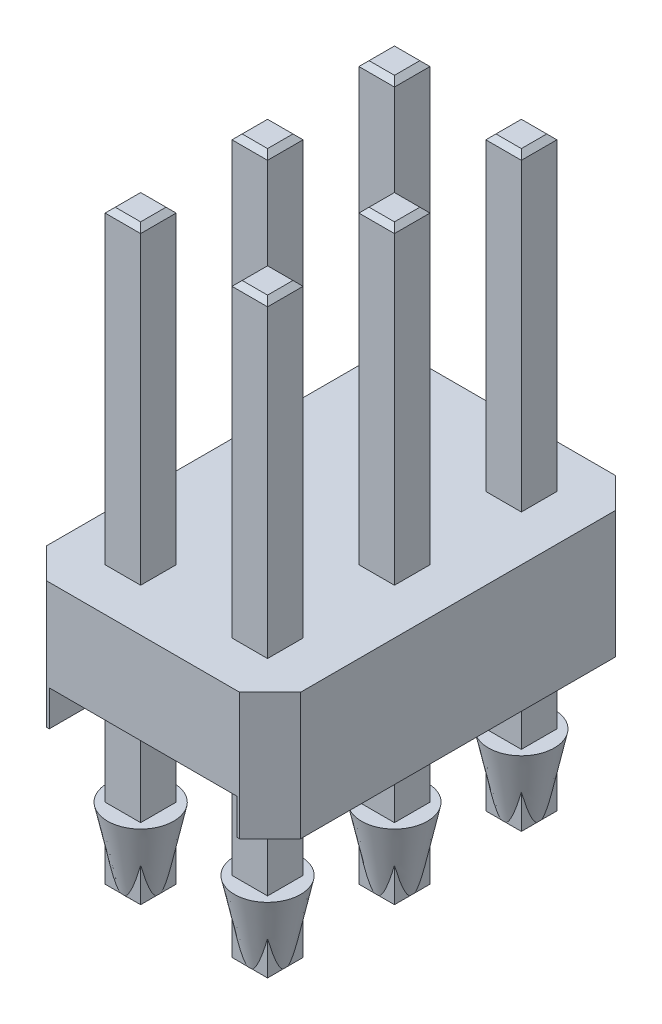
from build123d import *

# Parameters (mm, degrees)
ESQUISSE1_W                  = 5
ESQUISSE1_H                  = 7.4
BOSS_EXTRU_1_DEPTH           = 2.5
ESQUISSE3_W                  = 3.7
ESQUISSE3_H                  = 0.7
ENL_V_MAT_EXTRU_1_DEPTH      = 10.274157644
BOSS_EXTRU_2_DEPTH           = 6.1
BOSS_EXTRU_2_DEPTH_BACK      = 5.5
ESQUISSE2_W                  = 0.7
ESQUISSE2_H                  = 0.7
ESQUISSE4_R                  = 0.65
BOSS_EXTRU_3_DEPTH           = 1.4
BOSS_EXTRU_3_DRAFT           = -12
BOSS_EXTRU_3_PROFILE_2_DEPTH = 1.4
BOSS_EXTRU_3_PROFILE_2_DRAFT = -12
BOSS_EXTRU_3_PROFILE_3_DEPTH = 1.4
BOSS_EXTRU_3_PROFILE_3_DRAFT = -12
BOSS_EXTRU_3_PROFILE_4_DEPTH = 1.4
BOSS_EXTRU_3_PROFILE_4_DRAFT = -12
BOSS_EXTRU_3_PROFILE_5_DEPTH = 1.4
BOSS_EXTRU_3_PROFILE_5_DRAFT = -12
BOSS_EXTRU_3_PROFILE_6_DEPTH = 1.4
BOSS_EXTRU_3_PROFILE_6_DRAFT = -12
CHANFREIN1_SIZE              = 0.1
CHANFREIN2_SIZE              = 0.6
CHANFREIN3_SIZE              = 0.05


with BuildPart() as part:
    # Esquisse1 → Boss.-Extru.1 (new body)
    with BuildSketch(Plane(origin=(0, 0, 0), x_dir=(1, 0, 0), z_dir=(0, 1, 0))):
        with Locations((2.5, 3.7)):
            Rectangle(ESQUISSE1_W, ESQUISSE1_H)
    extrude(amount=BOSS_EXTRU_1_DEPTH)

    # Esquisse3 → Enlèv. mat.-Extru.1 (cut, through all)
    with BuildSketch(Plane.XY):
        with Locations((2.5, 0.35)):
            Rectangle(ESQUISSE3_W, ESQUISSE3_H)
    extrude(amount=-ENL_V_MAT_EXTRU_1_DEPTH, mode=Mode.SUBTRACT)

    # Esquisse2 → Boss.-Extru.2 (add, two sides: drawn at the far end of the back side and taken through both)
    with BuildSketch(Plane(origin=(0, 2.5, 0), x_dir=(1, 0, 0), z_dir=(0, 1, 0)).offset(-BOSS_EXTRU_2_DEPTH_BACK)):
        with Locations((1.25, 6.2)):
            Rectangle(ESQUISSE2_W, ESQUISSE2_H)
        with Locations((3.75, 6.2)):
            Rectangle(ESQUISSE2_W, ESQUISSE2_H)
        with Locations((1.25, 3.7)):
            Rectangle(ESQUISSE2_W, ESQUISSE2_H)
        with Locations((3.75, 3.7)):
            Rectangle(ESQUISSE2_W, ESQUISSE2_H)
        with Locations((1.25, 1.2)):
            Rectangle(ESQUISSE2_W, ESQUISSE2_H)
        with Locations((3.75, 1.2)):
            Rectangle(ESQUISSE2_W, ESQUISSE2_H)
    extrude(amount=BOSS_EXTRU_2_DEPTH + BOSS_EXTRU_2_DEPTH_BACK)


with BuildPart() as boss_extru_3_tool:
    # Esquisse4 → Boss.-Extru.3 (with draft: the straight prism first)
    with BuildSketch(Plane(origin=(0, -1.55, 0), x_dir=(1, 0, 0), z_dir=(0, 1, 0))):
        with Locations((1.25, 6.2)):
            Circle(ESQUISSE4_R)
    extrude(amount=-BOSS_EXTRU_3_DEPTH)
    # Boss.-Extru.3: the draft: its side faces are tilted about the plane it starts from
    boss_extru_3_sides = [boss_extru_3_tool.faces().sort_by_distance(p)[0] for p in [
        (0.6, -2.25, -6.2),
    ]]
    draft(boss_extru_3_sides, Plane(origin=(0, -1.55, 0), x_dir=(1, 0, 0), z_dir=(0, 1, 0)), BOSS_EXTRU_3_DRAFT)


with BuildPart() as part_1:
    add(part.part)

    # Boss.-Extru.3: add boss_extru_3_tool
    add(boss_extru_3_tool.part)


with BuildPart() as boss_extru_3_profile_2_tool:
    # Esquisse4 → Boss.-Extru.3 profile 2 (with draft: the straight prism first)
    with BuildSketch(Plane(origin=(0, -1.55, 0), x_dir=(1, 0, 0), z_dir=(0, 1, 0))):
        with Locations((1.25, 3.7)):
            Circle(ESQUISSE4_R)
    extrude(amount=-BOSS_EXTRU_3_PROFILE_2_DEPTH)
    # Boss.-Extru.3 profile 2: the draft: its side faces are tilted about the plane it starts from
    boss_extru_3_profile_2_sides = [boss_extru_3_profile_2_tool.faces().sort_by_distance(p)[0] for p in [
        (0.6, -2.25, -3.7),
    ]]
    draft(boss_extru_3_profile_2_sides, Plane(origin=(0, -1.55, 0), x_dir=(1, 0, 0), z_dir=(0, 1, 0)), BOSS_EXTRU_3_PROFILE_2_DRAFT)


with BuildPart() as part_2:
    add(part_1.part)

    # Boss.-Extru.3 profile 2: add boss_extru_3_profile_2_tool
    add(boss_extru_3_profile_2_tool.part)


with BuildPart() as boss_extru_3_profile_3_tool:
    # Esquisse4 → Boss.-Extru.3 profile 3 (with draft: the straight prism first)
    with BuildSketch(Plane(origin=(0, -1.55, 0), x_dir=(1, 0, 0), z_dir=(0, 1, 0))):
        with Locations((1.25, 1.2)):
            Circle(ESQUISSE4_R)
    extrude(amount=-BOSS_EXTRU_3_PROFILE_3_DEPTH)
    # Boss.-Extru.3 profile 3: the draft: its side faces are tilted about the plane it starts from
    boss_extru_3_profile_3_sides = [boss_extru_3_profile_3_tool.faces().sort_by_distance(p)[0] for p in [
        (0.6, -2.25, -1.2),
    ]]
    draft(boss_extru_3_profile_3_sides, Plane(origin=(0, -1.55, 0), x_dir=(1, 0, 0), z_dir=(0, 1, 0)), BOSS_EXTRU_3_PROFILE_3_DRAFT)


with BuildPart() as part_3:
    add(part_2.part)

    # Boss.-Extru.3 profile 3: add boss_extru_3_profile_3_tool
    add(boss_extru_3_profile_3_tool.part)


with BuildPart() as boss_extru_3_profile_4_tool:
    # Esquisse4 → Boss.-Extru.3 profile 4 (with draft: the straight prism first)
    with BuildSketch(Plane(origin=(0, -1.55, 0), x_dir=(1, 0, 0), z_dir=(0, 1, 0))):
        with Locations((3.75, 6.2)):
            Circle(ESQUISSE4_R)
    extrude(amount=-BOSS_EXTRU_3_PROFILE_4_DEPTH)
    # Boss.-Extru.3 profile 4: the draft: its side faces are tilted about the plane it starts from
    boss_extru_3_profile_4_sides = [boss_extru_3_profile_4_tool.faces().sort_by_distance(p)[0] for p in [
        (3.1, -2.25, -6.2),
    ]]
    draft(boss_extru_3_profile_4_sides, Plane(origin=(0, -1.55, 0), x_dir=(1, 0, 0), z_dir=(0, 1, 0)), BOSS_EXTRU_3_PROFILE_4_DRAFT)


with BuildPart() as part_4:
    add(part_3.part)

    # Boss.-Extru.3 profile 4: add boss_extru_3_profile_4_tool
    add(boss_extru_3_profile_4_tool.part)


with BuildPart() as boss_extru_3_profile_5_tool:
    # Esquisse4 → Boss.-Extru.3 profile 5 (with draft: the straight prism first)
    with BuildSketch(Plane(origin=(0, -1.55, 0), x_dir=(1, 0, 0), z_dir=(0, 1, 0))):
        with Locations((3.75, 3.7)):
            Circle(ESQUISSE4_R)
    extrude(amount=-BOSS_EXTRU_3_PROFILE_5_DEPTH)
    # Boss.-Extru.3 profile 5: the draft: its side faces are tilted about the plane it starts from
    boss_extru_3_profile_5_sides = [boss_extru_3_profile_5_tool.faces().sort_by_distance(p)[0] for p in [
        (3.1, -2.25, -3.7),
    ]]
    draft(boss_extru_3_profile_5_sides, Plane(origin=(0, -1.55, 0), x_dir=(1, 0, 0), z_dir=(0, 1, 0)), BOSS_EXTRU_3_PROFILE_5_DRAFT)


with BuildPart() as part_5:
    add(part_4.part)

    # Boss.-Extru.3 profile 5: add boss_extru_3_profile_5_tool
    add(boss_extru_3_profile_5_tool.part)


with BuildPart() as boss_extru_3_profile_6_tool:
    # Esquisse4 → Boss.-Extru.3 profile 6 (with draft: the straight prism first)
    with BuildSketch(Plane(origin=(0, -1.55, 0), x_dir=(1, 0, 0), z_dir=(0, 1, 0))):
        with Locations((3.75, 1.2)):
            Circle(ESQUISSE4_R)
    extrude(amount=-BOSS_EXTRU_3_PROFILE_6_DEPTH)
    # Boss.-Extru.3 profile 6: the draft: its side faces are tilted about the plane it starts from
    boss_extru_3_profile_6_sides = [boss_extru_3_profile_6_tool.faces().sort_by_distance(p)[0] for p in [
        (3.1, -2.25, -1.2),
    ]]
    draft(boss_extru_3_profile_6_sides, Plane(origin=(0, -1.55, 0), x_dir=(1, 0, 0), z_dir=(0, 1, 0)), BOSS_EXTRU_3_PROFILE_6_DRAFT)


with BuildPart() as part_6:
    add(part_5.part)

    # Boss.-Extru.3 profile 6: add boss_extru_3_profile_6_tool
    add(boss_extru_3_profile_6_tool.part)

    # Chanfrein1
    chanfrein1_edges = [part_6.edges().sort_by_distance(p)[0] for p in [
        (4.1, 8.6, -3.7),
        (3.75, 8.6, -3.35),
        (3.75, 8.6, -4.05),
        (3.4, 8.6, -3.7),
        (1.6, 8.6, -1.2),
        (1.25, 8.6, -1.55),
        (0.9, 8.6, -1.2),
        (1.25, 8.6, -0.85),
        (4.1, 8.6, -1.2),
        (3.75, 8.6, -0.85),
        (3.75, 8.6, -1.55),
        (3.4, 8.6, -1.2),
        (1.6, 8.6, -6.2),
        (1.25, 8.6, -6.55),
        (0.9, 8.6, -6.2),
        (1.25, 8.6, -5.85),
        (4.1, 8.6, -6.2),
        (3.75, 8.6, -5.85),
        (3.75, 8.6, -6.55),
        (3.4, 8.6, -6.2),
        (1.6, 8.6, -3.7),
        (1.25, 8.6, -4.05),
        (0.9, 8.6, -3.7),
        (1.25, 8.6, -3.35),
    ]]
    chamfer(chanfrein1_edges, length=CHANFREIN1_SIZE)

    # Chanfrein2
    chanfrein2_edges = [part_6.edges().sort_by_distance(p)[0] for p in [
        (0, 1.25, -7.4),
        (5, 1.25, -7.4),
        (5, 1.25, 0),
        (0, 1.25, 0),
    ]]
    chamfer(chanfrein2_edges, length=CHANFREIN2_SIZE)

    # Chanfrein3
    chanfrein3_edges = [part_6.edges().sort_by_distance(p)[0] for p in [
        (3.4, -3, -3.7),
        (3.75, -3, -4.05),
        (4.1, -3, -3.7),
        (3.75, -3, -3.35),
        (1.25, -3, -0.85),
        (0.9, -3, -1.2),
        (1.6, -3, -1.2),
        (1.25, -3, -1.55),
        (3.4, -3, -1.2),
        (3.75, -3, -1.55),
        (4.1, -3, -1.2),
        (3.75, -3, -0.85),
        (1.25, -3, -5.85),
        (0.9, -3, -6.2),
        (1.6, -3, -6.2),
        (1.25, -3, -6.55),
        (3.4, -3, -6.2),
        (3.75, -3, -6.55),
        (4.1, -3, -6.2),
        (3.75, -3, -5.85),
        (1.25, -3, -3.35),
        (0.9, -3, -3.7),
        (1.6, -3, -3.7),
        (1.25, -3, -4.05),
    ]]
    chamfer(chanfrein3_edges, length=CHANFREIN3_SIZE - 0.0001)  # a hair under: the kernel refuses the full size


solid = part_6.part
